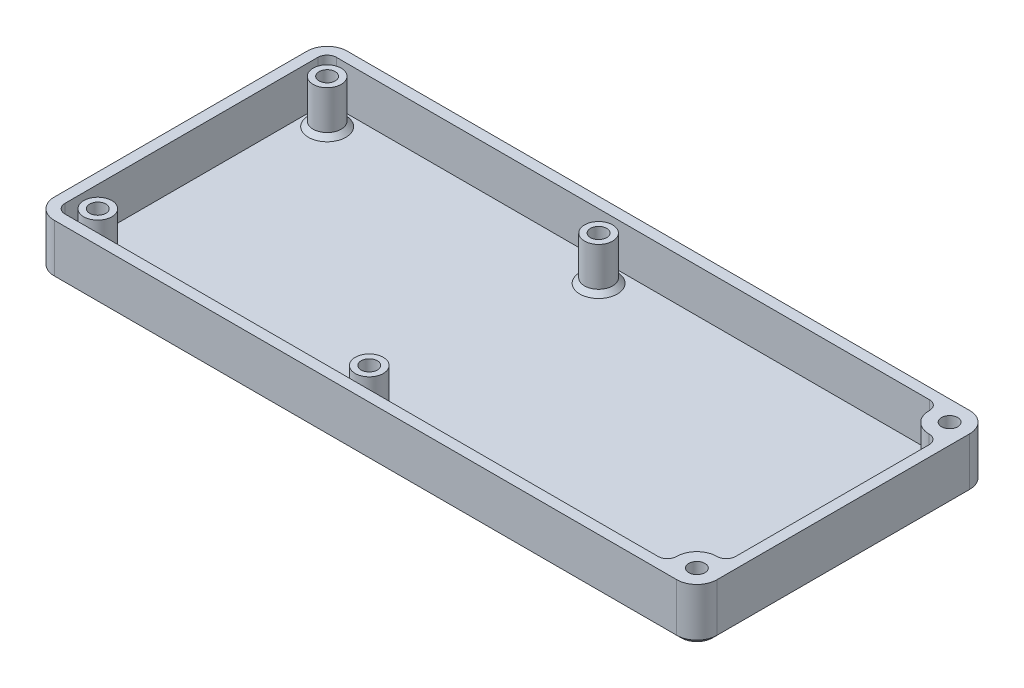
from build123d import *

# Parameters (mm, degrees)
SKETCH3_W                                         = 141.6
SKETCH3_H                                         = 62.6
SKETCH3_W_2                                       = 137
SKETCH3_H_2                                       = 58
BOSS_EXTRUDE1_DEPTH                               = 11.3
SKETCH5_W                                         = 137
SKETCH5_H                                         = 58
BOSS_EXTRUDE2_DEPTH                               = 2
SKETCH6_R                                         = 3
BOSS_EXTRUDE3_DEPTH                               = 9.3
FILLET6_R                                         = 2
FILLET8_R                                         = 2
CHAMFER1_SIZE                                     = 1
SKETCH24_R                                        = 4.3
BOSS_EXTRUDE7_DEPTH                               = 9.3
FILLET21_R                                        = 2
FILLET22_R                                        = 2
FILLET20_R                                        = 4.3
CSK_FOR_4_FLAT_HEAD_SOCKET_CAP_SCREW1_D           = 3.4544
CSK_FOR_4_FLAT_HEAD_SOCKET_CAP_SCREW1_DEPTH       = 14
CSK_FOR_4_FLAT_HEAD_SOCKET_CAP_SCREW1_CSINK_D     = 6.723761
CSK_FOR_4_FLAT_HEAD_SOCKET_CAP_SCREW1_CSINK_ANGLE = 82
CSK_FOR_4_FLAT_HEAD_SOCKET_CAP_SCREW1_TIP         = 1.037806461
CHAMFER7_SIZE                                     = 1


# Some blends are built 0.0001 mm under size
with BuildPart() as part:
    # Sketch3 → Boss-Extrude1 (new body)
    with BuildSketch(Plane(origin=(0, 0, 0), x_dir=(1, 0, 0), z_dir=(0, 1, 0))):
        with Locations((-4.061766162, 3.105993834)):
            Rectangle(SKETCH3_W, SKETCH3_H)
        with Locations((-4.061766162, 3.105993834)):
            Rectangle(SKETCH3_W_2, SKETCH3_H_2, mode=Mode.SUBTRACT)
    extrude(amount=BOSS_EXTRUDE1_DEPTH)

    # Sketch5 → Boss-Extrude2 (add)
    with BuildSketch(Plane(origin=(0, 0, 0), x_dir=(1, 0, 0), z_dir=(0, 1, 0))):
        with Locations((-4.061766162, 3.105993834)):
            Rectangle(SKETCH5_W, SKETCH5_H)
    extrude(amount=BOSS_EXTRUDE2_DEPTH)

    # Sketch6 → Boss-Extrude3 (add)
    with BuildSketch(Plane(origin=(0, 2, 0), x_dir=(1, 0, 0), z_dir=(0, 1, 0))):
        with Locations(Location((-68.061766162, 27.605993834, 0), (0, 0, 270))):
            Circle(SKETCH6_R)
        with Locations(Location((-68.061766162, -21.394006166, 0), (0, 0, 270))):
            Circle(SKETCH6_R)
        with Locations(Location((-10.061766162, -21.394006166, 0), (0, 0, 270))):
            Circle(SKETCH6_R)
        with Locations(Location((-10.061766162, 27.605993834, 0), (0, 0, 270))):
            Circle(SKETCH6_R)
    extrude(amount=BOSS_EXTRUDE3_DEPTH)

    # Fillet6
    fillet6_edges = [part.edges().sort_by_distance(p)[0] for p in [
        (64.438233838, 6.65, -32.105993834),
    ]]
    fillet(fillet6_edges, radius=FILLET6_R)

    # Fillet8
    fillet8_edges = [part.edges().sort_by_distance(p)[0] for p in [
        (-72.561766162, 6.65, -32.105993834),
        (-72.561766162, 6.65, 25.894006166),
    ]]
    fillet(fillet8_edges, radius=FILLET8_R)

    # Chamfer1
    chamfer1_edges = [part.edges().sort_by_distance(p)[0] for p in [
        (-68.061766162, 2, -30.605993834),
        (-68.061766162, 2, 18.394006166),
        (-10.061766162, 2, 18.394006166),
        (-10.061766162, 2, -30.605993834),
    ]]
    chamfer(chamfer1_edges, length=CHAMFER1_SIZE)

    # Sketch24 → Boss-Extrude7 (add)
    with BuildSketch(Plane(origin=(0, 2, 0), x_dir=(1, 0, 0), z_dir=(0, 1, 0))):
        with Locations((62.438233838, -23.894006166)):
            Circle(SKETCH24_R)
        with Locations((62.438233838, 30.01834388)):
            Circle(SKETCH24_R)
    extrude(amount=BOSS_EXTRUDE7_DEPTH)

    # Fillet21
    fillet21_edges = [part.edges().sort_by_distance(p)[0] for p in [
        (58.631660576, 6.65, 25.894006166),
    ]]
    fillet(fillet21_edges, radius=FILLET21_R)

    # Fillet22
    fillet22_edges = [part.edges().sort_by_distance(p)[0] for p in [
        (64.438233838, 6.65, -26.211770618),
        (58.679016144, 6.65, -32.105993834),
        (64.438233838, 6.65, 20.087432904),
    ]]
    fillet(fillet22_edges, radius=FILLET22_R)

    # Fillet20
    fillet20_edges = [part.edges().sort_by_distance(p)[0] for p in [
        (-74.861766162, 5.65, -34.405993834),
        (66.738233838, 5.65, -34.405993834),
        (66.738233838, 5.65, 28.194006166),
        (-74.861766162, 5.65, 28.194006166),
    ]]
    fillet(fillet20_edges, radius=FILLET20_R - 0.0001)  # a hair under: the kernel refuses the full size

    # CSK for #4 Flat Head Socket Cap Screw1
    with Locations(Plane(origin=(0, 0, 0), x_dir=(-1, 0, 0), z_dir=(0, -1, 0))):
        with Locations((68.061766162, 27.605993834), (68.061766162, -21.394006166), (-62.438233838, 30.105993834), (-62.438233838, -23.894006166), (10.061766162, -21.394006166), (10.061766162, 27.605993834)):
            CounterSinkHole(CSK_FOR_4_FLAT_HEAD_SOCKET_CAP_SCREW1_D / 2, CSK_FOR_4_FLAT_HEAD_SOCKET_CAP_SCREW1_CSINK_D / 2, depth=CSK_FOR_4_FLAT_HEAD_SOCKET_CAP_SCREW1_DEPTH, counter_sink_angle=CSK_FOR_4_FLAT_HEAD_SOCKET_CAP_SCREW1_CSINK_ANGLE)
            with Locations((0, 0, -(CSK_FOR_4_FLAT_HEAD_SOCKET_CAP_SCREW1_DEPTH + CSK_FOR_4_FLAT_HEAD_SOCKET_CAP_SCREW1_TIP / 2))):  # 118° drill point
                Cone(0, CSK_FOR_4_FLAT_HEAD_SOCKET_CAP_SCREW1_D / 2, CSK_FOR_4_FLAT_HEAD_SOCKET_CAP_SCREW1_TIP, mode=Mode.SUBTRACT)

    # Chamfer7
    # the kernel refuses this chamfer: 1 mm, written as the material it takes off along each edge
    with BuildSketch(Plane(origin=(62.438333838, 0, -34.405993834), x_dir=(0, -0.027495876610586292, 0.9996219169112968), z_dir=(-1, 0, 0)), Plane(origin=(-70.561866162, 0, 28.194006166), x_dir=(0, -0.02749587661058639, -0.9996219169112968), z_dir=(1, 0, 0))) as chamfer7_piece_1:
        Polygon((CHAMFER7_SIZE * 0.999621916911, CHAMFER7_SIZE * 0.0274958766106), (-CHAMFER7_SIZE * 0.0274958766106, CHAMFER7_SIZE * 0.999621916911), (0, 0), align=None)
    extrude(amount=133.0002, mode=Mode.SUBTRACT)
    with BuildSketch(Plane(origin=(-74.861766162, 0, -30.106093834), x_dir=(0.9996219169112968, -0.027495876610586483, 0), z_dir=(0, 0, 1)), Plane(origin=(66.738233838, 0, 23.894106166), x_dir=(-0.9996219169112968, -0.027495876610586483, 0), z_dir=(0, 0, -1))) as chamfer7_piece_2:
        Polygon((CHAMFER7_SIZE * 0.999621916911, CHAMFER7_SIZE * 0.0274958766106), (-CHAMFER7_SIZE * 0.0274958766106, CHAMFER7_SIZE * 0.999621916911), (0, 0), align=None)
    extrude(amount=54.0002, mode=Mode.SUBTRACT)
    with BuildSketch(Plane(origin=(62.438333838, 0, 23.894106166), x_dir=(0, 0, 1), z_dir=(-1, 0, 0))) as chamfer7_piece_3:
        Polygon((4.2999 - CHAMFER7_SIZE, 0), (4.2999, CHAMFER7_SIZE), (4.2999, 0), align=None)
    revolve(axis=Axis((62.438333838, 0, 23.894106166), (0, 1, 0)), revolution_arc=90, mode=Mode.SUBTRACT)
    with BuildSketch(Plane(origin=(-70.561866162, 0, 23.894106166), x_dir=(0, 0, 1), z_dir=(1, 0, 0))) as chamfer7_piece_4:
        Polygon((4.2999 - CHAMFER7_SIZE, 0), (4.2999, -CHAMFER7_SIZE), (4.2999, 0), align=None)
    revolve(axis=Axis((-70.561866162, 0, 23.894106166), (0, -1, 0)), revolution_arc=90, mode=Mode.SUBTRACT)
    with BuildSketch(Plane(origin=(-70.561866162, 0, -30.106093834), x_dir=(0, 0, -1), z_dir=(1, 0, 0))) as chamfer7_piece_5:
        Polygon((4.2999 - CHAMFER7_SIZE, 0), (4.2999, CHAMFER7_SIZE), (4.2999, 0), align=None)
    revolve(axis=Axis((-70.561866162, 0, -30.106093834), (0, 1, 0)), revolution_arc=90, mode=Mode.SUBTRACT)
    with BuildSketch(Plane(origin=(62.438333838, 0, -30.106093834), x_dir=(1, 0, 0), z_dir=(0, 0, 1))) as chamfer7_piece_6:
        Polygon((4.2999 - CHAMFER7_SIZE, 0), (4.2999, CHAMFER7_SIZE), (4.2999, 0), align=None)
    revolve(axis=Axis((62.438333838, 0, -30.106093834), (0, 1, 0)), revolution_arc=90, mode=Mode.SUBTRACT)


solid = part.part
